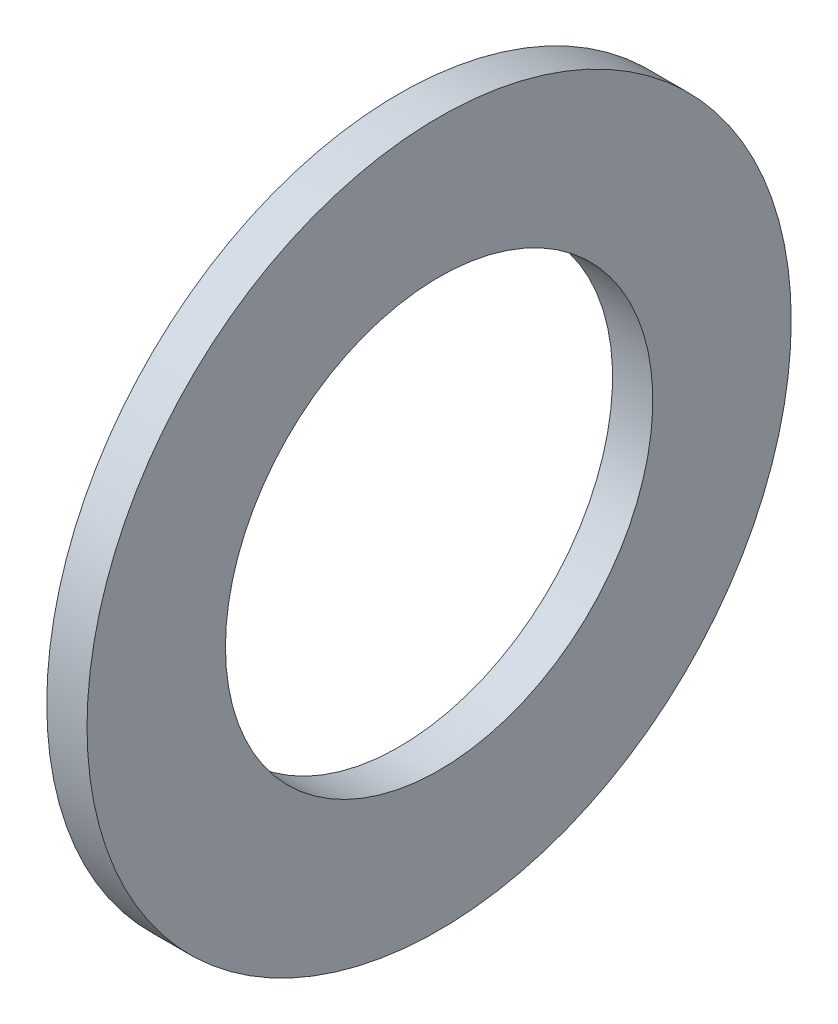
from build123d import *

# Parameters (mm, degrees)
SKETCH1_W = 2.54
SKETCH1_H = 8.7376


with BuildPart() as part:
    # Sketch1 → Base-Revolve (revolve)
    with BuildSketch(Plane.XY):
        with Locations((-1.27, 17.8562)):
            Rectangle(SKETCH1_W, SKETCH1_H)
    revolve(axis=Axis((-34.925, 0, 0), (1, 0, 0)))


solid = part.part
